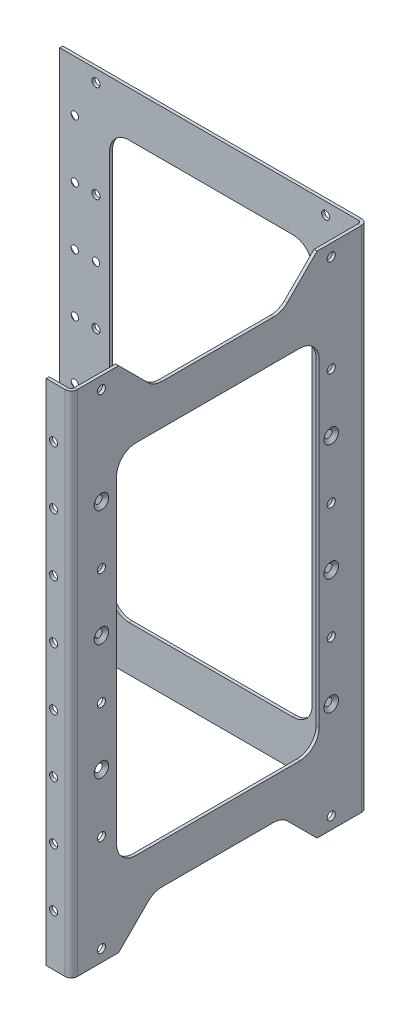
from build123d import *

# Parameters (mm, degrees)
SKETCH1_W                                       = 203.88
SKETCH1_H                                       = 168.2
BOSS_EXTRUDE1_DEPTH                             = 1
CUT_EXTRUDE1_DEPTH                              = 133.157381935
CUT_EXTRUDE2_DEPTH                              = 133.157381935
CUT_EXTRUDE3_DEPTH                              = 133.157381935
SKETCHED_START                                  = -1.329337245
SKETCHED_BEND11_OUTLINE_W                       = 168.2
SKETCHED_BEND11_OUTLINE_H                       = 1
SKETCHED_BEND11_DEPTH                           = 103.269337245
SKETCHED_START_2                                = -3.118097245
SKETCHED_BEND11_2_DEPTH                         = 2
SKETCHED_START_3                                = -84.1
SKETCHED_BEND11_3_DEPTH                         = 168.2
SKETCHED_BEND12_DEPTH                           = 168.2
SKETCHED_BEND12_2_DEPTH                         = 168.2
CSK_FOR_M2_FLAT_HEAD_MACHINE_SCREW6_AT_2_COUNT  = 2
CSK_FOR_M2_FLAT_HEAD_MACHINE_SCREW6_AT_2_PITCH  = 19.2
CSK_FOR_M2_FLAT_HEAD_MACHINE_SCREW6_AT_3_COUNT  = 2
CSK_FOR_M2_FLAT_HEAD_MACHINE_SCREW6_AT_3_PITCH  = 38.4
CSK_FOR_M2_FLAT_HEAD_MACHINE_SCREW6_AT_4_COUNT  = 2
CSK_FOR_M2_FLAT_HEAD_MACHINE_SCREW6_AT_4_PITCH  = 57.6
CSK_FOR_M2_FLAT_HEAD_MACHINE_SCREW6_AT_5_COUNT  = 2
CSK_FOR_M2_FLAT_HEAD_MACHINE_SCREW6_AT_5_PITCH  = 76.8
CSK_FOR_M2_FLAT_HEAD_MACHINE_SCREW6_AT_6_COUNT  = 2
CSK_FOR_M2_FLAT_HEAD_MACHINE_SCREW6_AT_6_PITCH  = 96
CSK_FOR_M2_FLAT_HEAD_MACHINE_SCREW6_AT_7_COUNT  = 2
CSK_FOR_M2_FLAT_HEAD_MACHINE_SCREW6_AT_7_PITCH  = 115.2
CSK_FOR_M2_FLAT_HEAD_MACHINE_SCREW6_AT_8_COUNT  = 2
CSK_FOR_M2_FLAT_HEAD_MACHINE_SCREW6_AT_8_PITCH  = 134.4
CSK_FOR_M2_FLAT_HEAD_MACHINE_SCREW6_AT_9_COUNT  = 2
CSK_FOR_M2_FLAT_HEAD_MACHINE_SCREW6_AT_9_PITCH  = 96.254870007
CSK_FOR_M2_FLAT_HEAD_MACHINE_SCREW6_AT_1_COUNT  = 2
CSK_FOR_M2_FLAT_HEAD_MACHINE_SCREW6_AT_1_PITCH  = 58.023788225
CSK_FOR_M2_FLAT_HEAD_MACHINE_SCREW6_2_COUNT     = 2
CSK_FOR_M2_FLAT_HEAD_MACHINE_SCREW6_2_PITCH     = 20.436242316
CSK_FOR_M2_FLAT_HEAD_MACHINE_SCREW6_3_COUNT     = 2
CSK_FOR_M2_FLAT_HEAD_MACHINE_SCREW6_3_PITCH     = 91.452501333
CSK_FOR_M2_FLAT_HEAD_MACHINE_SCREW6_4_COUNT     = 2
CSK_FOR_M2_FLAT_HEAD_MACHINE_SCREW6_4_PITCH     = 113.080679163
CSK_FOR_M2_FLAT_HEAD_MACHINE_SCREW6_5_COUNT     = 2
CSK_FOR_M2_FLAT_HEAD_MACHINE_SCREW6_5_PITCH     = 141.986055653
F_1_0MM_DOWEL_HOLE2_D                           = 2.69
F_1_0MM_DOWEL_HOLE3_D                           = 2.69
CSK_FOR_M2_FLAT_HEAD_MACHINE_SCREW5_D           = 2.39
CSK_FOR_M2_FLAT_HEAD_MACHINE_SCREW5_CSINK_D     = 4.8
CSK_FOR_M2_FLAT_HEAD_MACHINE_SCREW5_CSINK_ANGLE = 100
F_1_0MM_DOWEL_HOLE4_D                           = 2.69
F_1_0MM_DOWEL_HOLE4_DEPTH                       = 1


with BuildPart() as part:
    # Sketch1 → Boss-Extrude1 (new body)
    with BuildSketch(Plane.XY):
        Rectangle(SKETCH1_W, SKETCH1_H)
    extrude(amount=BOSS_EXTRUDE1_DEPTH)

    # Sketch2 → Cut-Extrude1 (cut, through all)
    with BuildSketch(Plane.XY.offset(1)):
        with BuildLine():
            Line((-85.44, 62.7), (-85.44, -62.7))
            ThreePointArc((-85.44, -62.7), (-83.5654834, -67.2254834), (-79.04, -69.1))
            Line((-79.04, -69.1), (-24.84, -69.1))
            ThreePointArc((-24.84, -69.1), (-20.3145166, -67.2254834), (-18.44, -62.7))
            Line((-18.44, -62.7), (-18.44, 62.7))
            ThreePointArc((-18.44, 62.7), (-20.3145166, 67.2254834), (-24.84, 69.1))
            Line((-24.84, 69.1), (-79.04, 69.1))
            ThreePointArc((-79.04, 69.1), (-83.5654834, 67.2254834), (-85.44, 62.7))
        make_face()
    extrude(amount=-CUT_EXTRUDE1_DEPTH, mode=Mode.SUBTRACT)

    # Sketch3 → Cut-Extrude2 (cut, through all)
    with BuildSketch(Plane.XY.offset(1)):
        with BuildLine():
            Line((13.25, 52.7), (13.25, -52.7))
            ThreePointArc((13.25, -52.7), (15.1245166, -57.2254834), (19.65, -59.1))
            Line((19.65, -59.1), (73.85, -59.1))
            ThreePointArc((73.85, -59.1), (78.3754834, -57.2254834), (80.25, -52.7))
            Line((80.25, -52.7), (80.25, 52.7))
            ThreePointArc((80.25, 52.7), (78.3754834, 57.2254834), (73.85, 59.1))
            Line((73.85, 59.1), (19.65, 59.1))
            ThreePointArc((19.65, 59.1), (15.1245166, 57.2254834), (13.25, 52.7))
        make_face()
    extrude(amount=-CUT_EXTRUDE2_DEPTH, mode=Mode.SUBTRACT)

    # Sketch4 → Cut-Extrude3 (cut, through all)
    with BuildSketch(Plane.XY.offset(1)):
        with BuildLine():
            Line((13.927709828, 84.1), (23.7245166, 74.303193228))
            ThreePointArc((23.7245166, 74.303193228), (25.800826033, 72.915847619), (28.25, 72.428676627))
            Line((28.25, 72.428676627), (65.25, 72.428676627))
            ThreePointArc((65.25, 72.428676627), (67.699173967, 72.915847619), (69.7754834, 74.303193228))
            Line((69.7754834, 74.303193228), (79.572290172, 84.1))
            Line((79.572290172, 84.1), (13.927709828, 84.1))
        make_face()
    cut_extrude3 = extrude(amount=-CUT_EXTRUDE3_DEPTH, mode=Mode.SUBTRACT)

    # Mirror1: Cut-Extrude3 across plane
    add(cut_extrude3.mirror(Plane.ZX), mode=Mode.SUBTRACT)

    # Sketched Bend11: read off the stored shape, not the designer's step
    # Sketched Bend11 outline → Sketched Bend11 (cut)
    with BuildSketch(Plane.YZ.offset(SKETCHED_START)):
        with Locations((0, 0.5)):
            Rectangle(SKETCHED_BEND11_OUTLINE_W, SKETCHED_BEND11_OUTLINE_H)
    extrude(amount=SKETCHED_BEND11_DEPTH, mode=Mode.SUBTRACT)

    # Sketched Bend11 2 outline → Sketched Bend11 2 (add)
    with BuildSketch(Plane.YZ.offset(SKETCHED_START_2)):
        with BuildLine():
            Line((-72.428676627, 68.011902755), (-72.428676627, 31.011902755))
            ThreePointArc((-72.428676627, 31.011902755), (-72.915847619, 28.562728788), (-74.303193228, 26.486419355))
            Line((-74.303193228, 26.486419355), (-84.1, 16.689612583))
            Line((-84.1, 16.689612583), (-84.1, 1))
            Line((-84.1, 1), (84.1, 1))
            Line((84.1, 1), (84.1, 16.689612583))
            Line((84.1, 16.689612583), (74.303193228, 26.486419355))
            ThreePointArc((74.303193228, 26.486419355), (72.915847619, 28.562728788), (72.428676627, 31.011902755))
            Line((72.428676627, 31.011902755), (72.428676627, 68.011902755))
            ThreePointArc((72.428676627, 68.011902755), (72.915847619, 70.461076722), (74.303193228, 72.537386154))
            Line((74.303193228, 72.537386154), (84.1, 82.334192927))
            Line((84.1, 82.334192927), (84.1, 104.701902755))
            Line((84.1, 104.701902755), (-84.1, 104.701902755))
            Line((-84.1, 104.701902755), (-84.1, 82.334192927))
            Line((-84.1, 82.334192927), (-74.303193228, 72.537386154))
            ThreePointArc((-74.303193228, 72.537386154), (-72.915847619, 70.461076722), (-72.428676627, 68.011902755))
        make_face()
        with BuildLine():
            Line((52.7, 16.011902755), (-52.7, 16.011902755))
            ThreePointArc((-52.7, 16.011902755), (-57.2254834, 17.886419355), (-59.1, 22.411902755))
            Line((-59.1, 22.411902755), (-59.1, 76.611902755))
            ThreePointArc((-59.1, 76.611902755), (-57.225483399, 81.137386155), (-52.7, 83.011902755))
            Line((-52.7, 83.011902755), (52.7, 83.011902755))
            ThreePointArc((52.7, 83.011902755), (57.225483399, 81.137386154), (59.1, 76.611902755))
            Line((59.1, 76.611902755), (59.1, 22.411902755))
            ThreePointArc((59.1, 22.411902755), (57.2254834, 17.886419355), (52.7, 16.011902755))
        make_face(mode=Mode.SUBTRACT)
    extrude(amount=SKETCHED_BEND11_2_DEPTH)

    # Sketched Bend11 3 outline → Sketched Bend11 3 (cut)
    with BuildSketch(Plane(origin=(0, 0, 0), x_dir=(1, 0, 0), z_dir=(0, 1, 0)).offset(SKETCHED_START_3)):
        with BuildLine():
            ThreePointArc((-3.118097245, 0), (-1.703883683, -0.585786438), (-1.118097245, -2))
            Line((-1.118097245, -2), (-1.118097245, -1))
            Line((-1.118097245, -1), (-1.329337245, -1))
            Line((-1.329337245, -1), (-1.329337245, 0))
            Line((-1.329337245, 0), (-3.118097245, 0))
        make_face()
        with BuildLine():
            ThreePointArc((-2.118097245, -2), (-2.410990464, -1.292893219), (-3.118097245, -1))
            Line((-3.118097245, -1), (-3.118097245, -104.701902755))
            Line((-3.118097245, -104.701902755), (-2.118097245, -104.701902755))
            Line((-2.118097245, -104.701902755), (-2.118097245, -2))
        make_face()
    extrude(amount=SKETCHED_BEND11_3_DEPTH, mode=Mode.SUBTRACT)

    # Sketched Bend12: read off the stored shape, not the designer's step
    # Sketched Bend12 outline → Sketched Bend12 (cut)
    with BuildSketch(Plane(origin=(0, 0, 0), x_dir=(1, 0, 0), z_dir=(0, 1, 0)).offset(SKETCHED_START_3)):
        with BuildLine():
            ThreePointArc((-1.118097245, -96.02380551), (-1.386046438, -97.02380551), (-2.118097245, -97.755856317))
            Line((-2.118097245, -97.755856317), (-2.118097245, -104.701902755))
            Line((-2.118097245, -104.701902755), (-1.118097245, -104.701902755))
            Line((-1.118097245, -104.701902755), (-1.118097245, -96.02380551))
        make_face()
    extrude(amount=SKETCHED_BEND12_DEPTH, mode=Mode.SUBTRACT)

    # Sketched Bend12 2 outline → Sketched Bend12 2 (add)
    with BuildSketch(Plane(origin=(0, 0, 0), x_dir=(1, 0, 0), z_dir=(0, 1, 0)).offset(SKETCHED_START_3)):
        with BuildLine():
            ThreePointArc((-2.118097245, -96.02380551), (-2.410990464, -96.730912291), (-3.118097245, -97.02380551))
            Line((-3.118097245, -97.02380551), (-9.44, -97.02380551))
            Line((-9.44, -97.02380551), (-9.44, -98.02380551))
            Line((-9.44, -98.02380551), (-3.118097245, -98.02380551))
            ThreePointArc((-3.118097245, -98.02380551), (-2.600459155, -97.955657162), (-2.118097245, -97.755856317))
            Line((-2.118097245, -97.755856317), (-2.118097245, -96.02380551))
        make_face()
    extrude(amount=SKETCHED_BEND12_2_DEPTH)

    # Sketch78 → CSK for M2 Flat Head Machine Screw6 (revolve, cut)
    with BuildSketch(Plane(origin=(-96.94, -67.2, 0), x_dir=(0, 1, 0), z_dir=(1, 0, 0))):
        Polygon((0, 0), (0, 1), (1.195, 1), (1.195, 1.011115056), (2.4, 0), align=None)
    csk_for_m2_flat_head_machine_screw6 = revolve(axis=Axis((-96.94, -67.2, -6.35), (0, 0, 1)), mode=Mode.SUBTRACT)

    # CSK for M2 Flat Head Machine Screw6 at 2: CSK for M2 Flat Head Machine Screw6 ×2
    with Locations(*[(0, i * CSK_FOR_M2_FLAT_HEAD_MACHINE_SCREW6_AT_2_PITCH, 0) for i in range(1, CSK_FOR_M2_FLAT_HEAD_MACHINE_SCREW6_AT_2_COUNT)]):
        add(csk_for_m2_flat_head_machine_screw6, mode=Mode.SUBTRACT)

    # CSK for M2 Flat Head Machine Screw6 at 3: CSK for M2 Flat Head Machine Screw6 ×2
    with Locations(*[(0, i * CSK_FOR_M2_FLAT_HEAD_MACHINE_SCREW6_AT_3_PITCH, 0) for i in range(1, CSK_FOR_M2_FLAT_HEAD_MACHINE_SCREW6_AT_3_COUNT)]):
        add(csk_for_m2_flat_head_machine_screw6, mode=Mode.SUBTRACT)

    # CSK for M2 Flat Head Machine Screw6 at 4: CSK for M2 Flat Head Machine Screw6 ×2
    with Locations(*[(0, i * CSK_FOR_M2_FLAT_HEAD_MACHINE_SCREW6_AT_4_PITCH, 0) for i in range(1, CSK_FOR_M2_FLAT_HEAD_MACHINE_SCREW6_AT_4_COUNT)]):
        add(csk_for_m2_flat_head_machine_screw6, mode=Mode.SUBTRACT)

    # CSK for M2 Flat Head Machine Screw6 at 5: CSK for M2 Flat Head Machine Screw6 ×2
    with Locations(*[(0, i * CSK_FOR_M2_FLAT_HEAD_MACHINE_SCREW6_AT_5_PITCH, 0) for i in range(1, CSK_FOR_M2_FLAT_HEAD_MACHINE_SCREW6_AT_5_COUNT)]):
        add(csk_for_m2_flat_head_machine_screw6, mode=Mode.SUBTRACT)

    # CSK for M2 Flat Head Machine Screw6 at 6: CSK for M2 Flat Head Machine Screw6 ×2
    with Locations(*[(0, i * CSK_FOR_M2_FLAT_HEAD_MACHINE_SCREW6_AT_6_PITCH, 0) for i in range(1, CSK_FOR_M2_FLAT_HEAD_MACHINE_SCREW6_AT_6_COUNT)]):
        add(csk_for_m2_flat_head_machine_screw6, mode=Mode.SUBTRACT)

    # CSK for M2 Flat Head Machine Screw6 at 7: CSK for M2 Flat Head Machine Screw6 ×2
    with Locations(*[(0, i * CSK_FOR_M2_FLAT_HEAD_MACHINE_SCREW6_AT_7_PITCH, 0) for i in range(1, CSK_FOR_M2_FLAT_HEAD_MACHINE_SCREW6_AT_7_COUNT)]):
        add(csk_for_m2_flat_head_machine_screw6, mode=Mode.SUBTRACT)

    # CSK for M2 Flat Head Machine Screw6 at 8: CSK for M2 Flat Head Machine Screw6 ×2
    with Locations(*[(0, i * CSK_FOR_M2_FLAT_HEAD_MACHINE_SCREW6_AT_8_PITCH, 0) for i in range(1, CSK_FOR_M2_FLAT_HEAD_MACHINE_SCREW6_AT_8_COUNT)]):
        add(csk_for_m2_flat_head_machine_screw6, mode=Mode.SUBTRACT)

    # CSK for M2 Flat Head Machine Screw6 at 9: CSK for M2 Flat Head Machine Screw6 ×2
    with Locations(*[Vector(0.07272359309731836, 0.9973521339060822, 0) * (i * CSK_FOR_M2_FLAT_HEAD_MACHINE_SCREW6_AT_9_PITCH) for i in range(1, CSK_FOR_M2_FLAT_HEAD_MACHINE_SCREW6_AT_9_COUNT)]):
        add(csk_for_m2_flat_head_machine_screw6, mode=Mode.SUBTRACT)

    # CSK for M2 Flat Head Machine Screw6 at 1: CSK for M2 Flat Head Machine Screw6 ×2
    with Locations(*[Vector(0.12064017559203119, 0.9926963020144298, 0) * (i * CSK_FOR_M2_FLAT_HEAD_MACHINE_SCREW6_AT_1_PITCH) for i in range(1, CSK_FOR_M2_FLAT_HEAD_MACHINE_SCREW6_AT_1_COUNT)]):
        add(csk_for_m2_flat_head_machine_screw6, mode=Mode.SUBTRACT)

    # CSK for M2 Flat Head Machine Screw6  2: CSK for M2 Flat Head Machine Screw6 ×2
    with Locations(*[Vector(0.34252872381068933, 0.939507356737892, 0) * (i * CSK_FOR_M2_FLAT_HEAD_MACHINE_SCREW6_2_PITCH) for i in range(1, CSK_FOR_M2_FLAT_HEAD_MACHINE_SCREW6_2_COUNT)]):
        add(csk_for_m2_flat_head_machine_screw6, mode=Mode.SUBTRACT)

    # CSK for M2 Flat Head Machine Screw6  3: CSK for M2 Flat Head Machine Screw6 ×2
    with Locations(*[Vector(0.9075749573878468, 0.41989010076738914, 0) * (i * CSK_FOR_M2_FLAT_HEAD_MACHINE_SCREW6_3_PITCH) for i in range(1, CSK_FOR_M2_FLAT_HEAD_MACHINE_SCREW6_3_COUNT)]):
        add(csk_for_m2_flat_head_machine_screw6, mode=Mode.SUBTRACT)

    # CSK for M2 Flat Head Machine Screw6  4: CSK for M2 Flat Head Machine Screw6 ×2
    with Locations(*[Vector(0.7339892244567021, 0.6791611137141532, 0) * (i * CSK_FOR_M2_FLAT_HEAD_MACHINE_SCREW6_4_PITCH) for i in range(1, CSK_FOR_M2_FLAT_HEAD_MACHINE_SCREW6_4_COUNT)]):
        add(csk_for_m2_flat_head_machine_screw6, mode=Mode.SUBTRACT)

    # CSK for M2 Flat Head Machine Screw6  5: CSK for M2 Flat Head Machine Screw6 ×2
    with Locations(*[Vector(0.5845644462624657, 0.8113472796317597, 0) * (i * CSK_FOR_M2_FLAT_HEAD_MACHINE_SCREW6_5_PITCH) for i in range(1, CSK_FOR_M2_FLAT_HEAD_MACHINE_SCREW6_5_COUNT)]):
        add(csk_for_m2_flat_head_machine_screw6, mode=Mode.SUBTRACT)

    # Ø1.0mm Dowel Hole2 (through all)
    with Locations(Plane(origin=(0, 0, 0), x_dir=(-1, 0, 0), z_dir=(0, 0, -1))):
        with Locations((89.94, 80.1), (89.94, -80.1), (13.94, -80.1), (13.94, 80.1), (89.94, 48), (89.94, 9.6), (89.94, -28.8), (13.94, 28.8), (13.94, -9.6), (13.94, -48)):
            Hole(F_1_0MM_DOWEL_HOLE2_D / 2)

    # Ø1.0mm Dowel Hole3 (through all)
    with Locations(Plane(origin=(-1.118097245, 0, 0), x_dir=(0, 0, -1), z_dir=(1, 0, 0))):
        with Locations((-12, 80.1), (-88.02380551, 80.1), (-12, 48), (-88.02380551, 28.8), (-12, 9.6), (-88.02380551, -9.6), (-12, -28.8), (-88.02380551, -48), (-88.02380551, -80.1), (-12, -80.1)):
            Hole(F_1_0MM_DOWEL_HOLE3_D / 2)

    # CSK for M2 Flat Head Machine Screw5 (through all)
    with Locations(Plane(origin=(-1.118097245, 0, 0), x_dir=(0, 0, -1), z_dir=(1, 0, 0))):
        with Locations((-88.02380551, 48), (-12, 28.8), (-88.02380551, 9.6), (-12, -9.6), (-88.02380551, -28.8), (-12, -48)):
            CounterSinkHole(CSK_FOR_M2_FLAT_HEAD_MACHINE_SCREW5_D / 2, CSK_FOR_M2_FLAT_HEAD_MACHINE_SCREW5_CSINK_D / 2, counter_sink_angle=CSK_FOR_M2_FLAT_HEAD_MACHINE_SCREW5_CSINK_ANGLE)

    # Ø1.0mm Dowel Hole4
    with Locations(Plane.XY.offset(98.02380551)):
        with Locations((-6.94, 67.2), (-6.94, 48), (-6.94, 28.8), (-6.94, 9.6), (-6.94, -9.6), (-6.94, -28.8), (-6.94, -48), (-6.94, -67.2)):
            Hole(F_1_0MM_DOWEL_HOLE4_D / 2, depth=F_1_0MM_DOWEL_HOLE4_DEPTH)


solid = part.part
